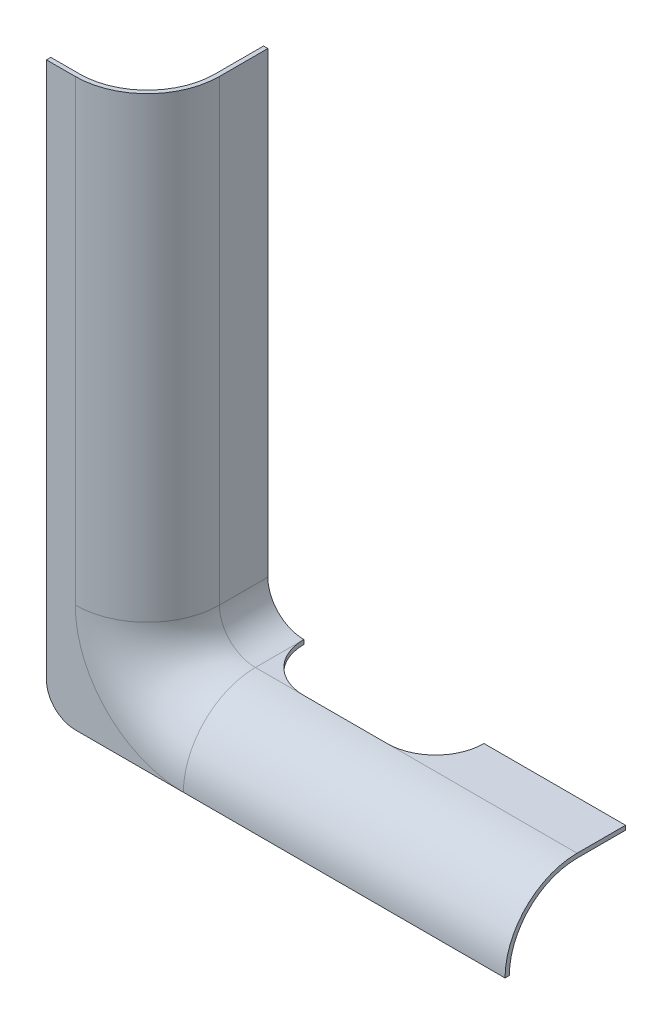
from build123d import *

# Parameters (mm, degrees)
BOSS_EXTRUDE1_DEPTH = 33.45
FILLET1_R           = 10
FILLET2_R           = 20
SHELL1_START        = -80.731515082
SHELL1_OUTLINE_W    = 157.075623287
SHELL1_OUTLINE_H    = 32.25
SHELL1_DEPTH        = 38
SHELL1_START_2      = -52.731515082
SHELL1_2_DEPTH      = 99.290578512
SHELL1_START_3      = -714.702863061
SHELL1_3_DEPTH      = 127.075623287
SHELL1_4_ANGLE      = 90
CUT_EXTRUDE1_REACH  = 164.561


with BuildPart() as part:
    # Sketch1 → Boss-Extrude1 (new body)
    with BuildSketch(Plane.XY):
        with BuildLine():
            Line((46.55906343, -744.702863061), (-72.731515082, -744.702863061))
            ThreePointArc((-72.731515082, -744.702863061), (-78.388369332, -742.359717311), (-80.731515082, -736.702863061))
            Line((-80.731515082, -736.702863061), (-80.731515082, -587.627239774))
            Line((-80.731515082, -587.627239774), (-52.731515082, -587.627239774))
            Line((-52.731515082, -587.627239774), (-52.731515082, -724.702863061))
            Line((-52.731515082, -724.702863061), (46.55906343, -724.702863061))
            Line((46.55906343, -724.702863061), (46.55906343, -744.702863061))
        make_face()
    extrude(amount=BOSS_EXTRUDE1_DEPTH)

    # Fillet1
    fillet1_edges = [part.edges().sort_by_distance(p)[0] for p in [
        (-52.731515082, -724.702863061, 16.725),
    ]]
    fillet(fillet1_edges, radius=FILLET1_R)

    # Fillet2
    fillet2_edges = [part.edges().sort_by_distance(p)[0] for p in [
        (-52.731515082, -651.165051418, 33.45),
        (-49.802582894, -721.773930873, 33.45),
        (1.913774174, -724.702863061, 33.45),
    ]]
    fillet(fillet2_edges, radius=FILLET2_R - 0.0001)  # a hair under: the kernel refuses the full size

    # Shell1: read off the stored shape, not the designer's step
    # Shell1 outline → Shell1 (cut)
    with BuildSketch(Plane.YZ.offset(SHELL1_START)):
        with Locations((-666.165051418, 16.125)):
            Rectangle(SHELL1_OUTLINE_W, SHELL1_OUTLINE_H)
    extrude(amount=SHELL1_DEPTH, mode=Mode.SUBTRACT)

    # Shell1 2 outline → Shell1 2 (cut)
    with BuildSketch(Plane.YZ.offset(SHELL1_START_2)):
        with BuildLine():
            Line((-725.902863061, 0), (-725.902863061, 13.45))
            ThreePointArc((-725.902863061, 13.45), (-731.409255575, 26.743607486), (-744.702863061, 32.25))
            Line((-744.702863061, 32.25), (-744.702863061, 0))
            Line((-744.702863061, 0), (-725.902863061, 0))
        make_face()
    extrude(amount=SHELL1_2_DEPTH, mode=Mode.SUBTRACT)

    # Shell1 3 outline → Shell1 3 (add)
    with BuildSketch(Plane(origin=(0, 0, 0), x_dir=(1, 0, 0), z_dir=(0, 1, 0)).offset(SHELL1_START_3)):
        with BuildLine():
            Line((-52.731515082, -13.45), (-52.731515082, 0))
            Line((-52.731515082, 0), (-53.931515082, 0))
            Line((-53.931515082, 0), (-53.931515082, -13.45))
            ThreePointArc((-53.931515082, -13.45), (-59.437907596, -26.743607486), (-72.731515082, -32.25))
            Line((-72.731515082, -32.25), (-65.908026238, -32.25))
            ThreePointArc((-65.908026238, -32.25), (-56.353637062, -24.928898534), (-52.731515082, -13.45))
        make_face()
    extrude(amount=SHELL1_3_DEPTH)

    # Shell1 4 outline → Shell1 4 (revolve)
    with BuildSketch(Plane(origin=(-42.731515082, -714.702863061, 0), x_dir=(-1, 0, 0), z_dir=(0, 1, 0))):
        with BuildLine():
            Line((10, 13.45), (10, 0))
            Line((10, 0), (11.2, 0))
            Line((11.2, 0), (11.2, 13.45))
            ThreePointArc((11.2, 13.45), (16.706392514, 26.743607486), (30, 32.25))
            Line((30, 32.25), (23.176511156, 32.25))
            ThreePointArc((23.176511156, 32.25), (13.62212198, 24.928898534), (10, 13.45))
        make_face()
    revolve(axis=Axis((-42.731515082, -714.702863061, 0), (0, 0, 1)), revolution_arc=SHELL1_4_ANGLE)

    # Cut-Extrude1: up to this face of the body (flat: up to its plane)
    cut_extrude1_end = Plane(part.part.faces().sort_by_distance((1.913774174, -725.902863061, 6.725))[0])
    # Sketch3 → Cut-Extrude1 (cut, up to the picked face)
    with BuildSketch(Plane(origin=(0, -724.702863061, 0), x_dir=(1, 0, 0), z_dir=(0, 1, 0)), mode=Mode.PRIVATE) as cut_extrude1_sk1:
        with BuildLine():
            Line((-29.281515082, 13.45), (-6.181515082, 13.45))
            ThreePointArc((-6.181515082, 13.45), (7.268484918, 0), (-6.181515082, -13.45))
            Line((-6.181515082, -13.45), (-29.281515082, -13.45))
            ThreePointArc((-29.281515082, -13.45), (-42.731515082, 0), (-29.281515082, 13.45))
        make_face()
    cut_extrude1_tool1 = split(extrude(cut_extrude1_sk1.sketch, amount=-CUT_EXTRUDE1_REACH, mode=Mode.PRIVATE), bisect_by=cut_extrude1_end, keep=Keep.BOTH, mode=Mode.PRIVATE)
    add(cut_extrude1_tool1.solids().sort_by(Axis((-17.731515, -724.702863, 0), (0, -1, 0)))[0], mode=Mode.SUBTRACT)


solid = part.part
